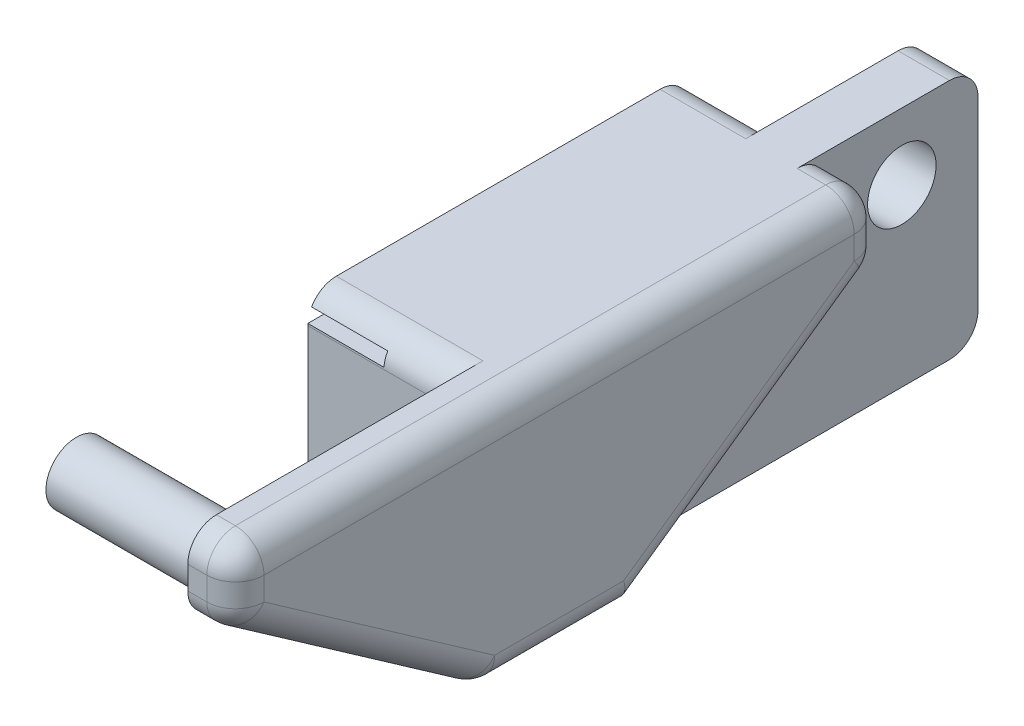
from build123d import *

# Parameters (mm, degrees)
BOSS_EXTRUDE1_DEPTH = 12.7
CUT_EXTRUDE2_DEPTH  = 4.5
CUT_EXTRUDE3_DEPTH  = 29.629690424
BOSS_EXTRUDE2_START = -7.7
SKETCH2_5_R         = 1.6
BOSS_EXTRUDE2_DEPTH = 9.1
SKETCH2_6_R         = 1.8
CUT_EXTRUDE4_DEPTH  = 29.629690424
SKETCH2_7_R         = 1.6
BOSS_EXTRUDE3_DEPTH = 1.4
SKETCH2_8_W         = 42
SKETCH2_8_H         = 0.65
CUT_EXTRUDE5_DEPTH  = 4
CUT_EXTRUDE6_REACH  = 31.158
SKETCH4_W           = 1.5
SKETCH4_H           = 28
CUT_EXTRUDE7_DEPTH  = 3
SKETCH6_W           = 2.1
SKETCH6_H           = 6.861038338
BOSS_EXTRUDE4_DEPTH = 1
CUT_EXTRUDE8_DEPTH  = 4.5
FILLET1_R           = 1.5
FILLET2_R           = 0.25


with BuildPart() as part:
    # Sketch1 → Boss-Extrude1 (new body)
    with BuildSketch(Plane(origin=(0, 0, 0), x_dir=(1, 0, 0), z_dir=(0, 1, 0))):
        Polygon((-28.77817965, 15.54419618), (-24.27817965, 15.54419618), (-24.27817965, 23.54419618), (-21.57817965, 23.54419618), (-21.57817965, 15.54419618), (-18.57817965, 15.54419618), (-18.57817965, -18.45580382), (-21.07817965, -18.45580382), (-21.07817965, -4.45580382), (-28.77817965, -4.45580382), align=None)
    extrude(amount=BOSS_EXTRUDE1_DEPTH)

    # Sketch2 → Cut-Extrude2 (cut)
    with BuildSketch(Plane.ZY.offset(28.77817965)):
        Polygon((-15.54419618, 5.764870839), (-15.54419618, 0), (-7.040359819, 0), align=None)
    extrude(amount=-CUT_EXTRUDE2_DEPTH, mode=Mode.SUBTRACT)

    # Sketch2<4> → Cut-Extrude3 (cut, through all)
    with BuildSketch(Plane.ZY.offset(28.77817965)):
        Polygon((12.124702683, 0), (18.45580382, 0), (18.45580382, 9.2), align=None)
    extrude(amount=-CUT_EXTRUDE3_DEPTH, mode=Mode.SUBTRACT)

    # Sketch2<5> → Boss-Extrude2 (add)
    with BuildSketch(Plane.ZY.offset(28.77817965).offset(BOSS_EXTRUDE2_START)):
        with Locations(Location((15.20580382, 9.2, 0), (0, 0, 180))):
            Circle(SKETCH2_5_R)
    extrude(amount=BOSS_EXTRUDE2_DEPTH)

    # Sketch2<6> → Cut-Extrude4 (cut, through all)
    with BuildSketch(Plane.ZY.offset(28.77817965)):
        with Locations((-19.54419618, 9.2)):
            Circle(SKETCH2_6_R)
    extrude(amount=-CUT_EXTRUDE4_DEPTH, mode=Mode.SUBTRACT)

    # Sketch2<7> → Boss-Extrude3 (add)
    with BuildSketch(Plane.ZY.offset(28.77817965)):
        with Locations(Location((-12.29419618, 9.2, 0), (0, 0, 180))):
            Circle(SKETCH2_7_R)
    extrude(amount=BOSS_EXTRUDE3_DEPTH)

    # Sketch2<8> → Cut-Extrude5 (cut)
    with BuildSketch(Plane.ZY.offset(28.77817965)):
        with Locations((-2.54419618, 11.625)):
            Rectangle(SKETCH2_8_W, SKETCH2_8_H)
    extrude(amount=-CUT_EXTRUDE5_DEPTH, mode=Mode.SUBTRACT)

    # Cut-Extrude6: up to this face of the body (flat: up to its plane)
    cut_extrude6_end = Plane(part.part.faces().sort_by_distance((-21.57817965, 6.032683514, -19.54419618))[0])
    # Sketch3 → Cut-Extrude6 (cut, up to the picked face)
    with BuildSketch(Plane(origin=(-18.57817965, 0, 0), x_dir=(0, 0, -1), z_dir=(1, 0, 0)), mode=Mode.PRIVATE) as cut_extrude6_sk1:
        Polygon((15.54419618, 0), (15.54419618, 9.2), (2.405234518, 0), align=None)
    cut_extrude6_tool1 = split(extrude(cut_extrude6_sk1.sketch, amount=-CUT_EXTRUDE6_REACH, mode=Mode.PRIVATE), bisect_by=cut_extrude6_end, keep=Keep.BOTH, mode=Mode.PRIVATE)
    # Sketch3 → Cut-Extrude6 (cut, up to the picked face)
    with BuildSketch(Plane(origin=(-18.57817965, 0, 0), x_dir=(0, 0, -1), z_dir=(1, 0, 0)), mode=Mode.PRIVATE) as cut_extrude6_sk2:
        Polygon((-12.124702683, 0), (-18.45580382, 9.2), (-18.45580382, 0), align=None)
    cut_extrude6_tool2 = split(extrude(cut_extrude6_sk2.sketch, amount=-CUT_EXTRUDE6_REACH, mode=Mode.PRIVATE), bisect_by=cut_extrude6_end, keep=Keep.BOTH, mode=Mode.PRIVATE)
    # Sketch3 → Cut-Extrude6 (cut, up to the picked face)
    with BuildSketch(Plane(origin=(-18.57817965, 0, 0), x_dir=(0, 0, -1), z_dir=(1, 0, 0)), mode=Mode.PRIVATE) as cut_extrude6_sk3:
        Polygon((-5.316842158, 0), (-18.45580382, 9.2), (-12.124702683, 0), align=None)
    cut_extrude6_tool3 = split(extrude(cut_extrude6_sk3.sketch, amount=-CUT_EXTRUDE6_REACH, mode=Mode.PRIVATE), bisect_by=cut_extrude6_end, keep=Keep.BOTH, mode=Mode.PRIVATE)
    add(cut_extrude6_tool1.solids().sort_by(Axis((-18.57818, 3.066667, -11.164542), (-1, 0, 0)))[0], mode=Mode.SUBTRACT)
    add(cut_extrude6_tool2.solids().sort_by(Axis((-18.57818, 3.066667, 16.345437), (-1, 0, 0)))[0], mode=Mode.SUBTRACT)
    add(cut_extrude6_tool3.solids().sort_by(Axis((-18.57818, 3.066667, 11.965783), (-1, 0, 0)))[0], mode=Mode.SUBTRACT)

    # Sketch4 → Cut-Extrude7 (cut)
    with BuildSketch(Plane.XZ):
        with Locations((-22.92817965, -9.54419618)):
            Rectangle(SKETCH4_W, SKETCH4_H)
    extrude(amount=-CUT_EXTRUDE7_DEPTH, mode=Mode.SUBTRACT)

    # Sketch6 → Boss-Extrude4 (add)
    with BuildSketch(Plane(origin=(0, 0, 0), x_dir=(-1, 0, 0), z_dir=(0, -1, 0))):
        with Locations((22.62817965, -1.025284651)):
            Rectangle(SKETCH6_W, SKETCH6_H)
    extrude(amount=-BOSS_EXTRUDE4_DEPTH)

    # Sketch8 → Cut-Extrude8 (cut)
    with BuildSketch(Plane.ZY.offset(28.77817965)):
        Polygon((-15.54419618, 0), (-7.040359819, 0), (-15.54419618, 5.764870839), align=None)
        Polygon((-7.040359819, 0), (-2.405234518, 0), (-15.54419618, 9.2), (-15.54419618, 5.764870839), align=None)
    extrude(amount=-CUT_EXTRUDE8_DEPTH, mode=Mode.SUBTRACT)

    # Fillet1
    # the kernel refuses this fillet: 1.5 mm, written as the material it takes off along each edge
    with BuildSketch(Plane(origin=(-20.07817965, 9.980850576, 16.95580382), x_dir=(0, 0, 1), z_dir=(1, 0, 0))) as fillet1_piece_1_section:
        Polygon((0, 0), (FILLET1_R, 0), (FILLET1_R, FILLET1_R * 0.520567050552), (FILLET1_R * 0.573576436351, FILLET1_R * 0.819152044289), align=None)
    fillet1_piece_1 = extrude(amount=FILLET1_R, mode=Mode.PRIVATE)
    fillet1_piece_1 = fillet1_piece_1 - Plane(origin=(-20.07817965, 9.980850576, 16.95580382), x_dir=(0, 0.46174861323503175, -0.8870108331782229), z_dir=(1, 0, 0)) * Sphere(FILLET1_R, mode=Mode.PRIVATE)
    add(fillet1_piece_1, mode=Mode.SUBTRACT)
    with BuildSketch(Plane(origin=(-20.07817965, 11.2, 16.95580382), x_dir=(1, 0, 0), z_dir=(0, 1, 0))) as fillet1_piece_2_section:
        Polygon((0, 0), (FILLET1_R, 0), (FILLET1_R, -FILLET1_R), (0, -FILLET1_R), align=None)
    fillet1_piece_2 = extrude(amount=FILLET1_R, mode=Mode.PRIVATE)
    fillet1_piece_2 = fillet1_piece_2 - Plane(origin=(-20.07817965, 11.2, 16.95580382), x_dir=(-0.7071067811865476, 0, -0.7071067811865474), z_dir=(0, 1, 0)) * Sphere(FILLET1_R, mode=Mode.PRIVATE)
    add(fillet1_piece_2, mode=Mode.SUBTRACT)
    with BuildSketch(Plane(origin=(-20.07817965, 1.5, 4.843893974), x_dir=(0, -0.8191520442889889, 0.5735764363510503), z_dir=(1, 0, 0))) as fillet1_piece_3_section:
        Polygon((0, 0), (FILLET1_R, 0), (FILLET1_R, FILLET1_R * 0.315298788879), (FILLET1_R * 0.819152044289, FILLET1_R * 0.573576436351), align=None)
    fillet1_piece_3 = extrude(amount=FILLET1_R, mode=Mode.PRIVATE)
    fillet1_piece_3 = fillet1_piece_3 - Plane(origin=(-20.07817965, 1.5, 4.843893974), x_dir=(0, 0.9537169507482263, -0.30070579950427556), z_dir=(1, 0, 0)) * Sphere(FILLET1_R, mode=Mode.PRIVATE)
    add(fillet1_piece_3, mode=Mode.SUBTRACT)
    with BuildSketch(Plane(origin=(-20.07817965, 9.980850576, -14.04419618), x_dir=(0, 0, -1), z_dir=(1, 0, 0))) as fillet1_piece_4_section:
        Polygon((0, 0), (FILLET1_R, 0), (FILLET1_R, -FILLET1_R * 0.520567050552), (FILLET1_R * 0.573576436351, -FILLET1_R * 0.819152044289), align=None)
    fillet1_piece_4 = extrude(amount=FILLET1_R, mode=Mode.PRIVATE)
    fillet1_piece_4 = fillet1_piece_4 - Plane(origin=(-20.07817965, 9.980850576, -14.04419618), x_dir=(0, 0.4617486132350316, 0.8870108331782229), z_dir=(1, 0, 0)) * Sphere(FILLET1_R, mode=Mode.PRIVATE)
    add(fillet1_piece_4, mode=Mode.SUBTRACT)
    with BuildSketch(Plane(origin=(-20.07817965, 11.2, -14.04419618), x_dir=(1, 0, 0), z_dir=(0, 1, 0))) as fillet1_piece_5_section:
        Polygon((0, 0), (FILLET1_R, 0), (FILLET1_R, FILLET1_R), (0, FILLET1_R), align=None)
    fillet1_piece_5 = extrude(amount=FILLET1_R, mode=Mode.PRIVATE)
    fillet1_piece_5 = fillet1_piece_5 - Plane(origin=(-20.07817965, 11.2, -14.04419618), x_dir=(-0.7071067811865475, 0, 0.7071067811865477), z_dir=(0, 1, 0)) * Sphere(FILLET1_R, mode=Mode.PRIVATE)
    add(fillet1_piece_5, mode=Mode.SUBTRACT)
    with BuildSketch(Plane(origin=(-21.07817965, 0, 4.45580382), x_dir=(0, 1, 0), z_dir=(-1, 0, 0))) as fillet1_piece_6:
        with BuildLine():
            CenterArc((FILLET1_R, FILLET1_R), FILLET1_R, 180, 90)
            Line((0, FILLET1_R), (0, 0))
            Line((0, 0), (FILLET1_R, 0))
        make_face()
    extrude(amount=11.45, mode=Mode.SUBTRACT)
    with BuildSketch(Plane(origin=(-21.07817965, 12.7, 4.45580382), x_dir=(0, -1, 0), z_dir=(-1, 0, 0))) as fillet1_piece_7:
        with BuildLine():
            CenterArc((FILLET1_R, -FILLET1_R), FILLET1_R, 90, 90)
            Line((0, -FILLET1_R), (0, 0))
            Line((0, 0), (FILLET1_R, 0))
        make_face()
    extrude(amount=11.45, mode=Mode.SUBTRACT)
    with BuildSketch(Plane(origin=(-25.92817965, 0, -23.54419618), x_dir=(0, 1, 0), z_dir=(1, 0, 0)), Plane(origin=(-28.02817965, 0, -23.54419618), x_dir=(0, 1, 0), z_dir=(1, 0, 0))) as fillet1_piece_8:
        with BuildLine():
            CenterArc((FILLET1_R, FILLET1_R), FILLET1_R, 180, 90)
            Line((0, FILLET1_R), (0, 0))
            Line((0, 0), (FILLET1_R, 0))
        make_face()
    extrude(amount=8.1, mode=Mode.SUBTRACT)
    with BuildSketch(Plane(origin=(-28.02817965, 12.7, -23.54419618), x_dir=(0, -1, 0), z_dir=(1, 0, 0))) as fillet1_piece_9:
        with BuildLine():
            CenterArc((FILLET1_R, -FILLET1_R), FILLET1_R, 90, 90)
            Line((0, -FILLET1_R), (0, 0))
            Line((0, 0), (FILLET1_R, 0))
        make_face()
    extrude(amount=10.2, mode=Mode.SUBTRACT)
    with BuildSketch(Plane(origin=(-18.57817965, 9.980850576, 18.45580382), x_dir=(0, 0, -1), z_dir=(0, 1, 0))) as fillet1_piece_10:
        with BuildLine():
            CenterArc((FILLET1_R, FILLET1_R), FILLET1_R, 180, 90)
            Line((0, FILLET1_R), (0, 0))
            Line((0, 0), (FILLET1_R, 0))
        make_face()
    extrude(amount=1.219149424, mode=Mode.SUBTRACT)
    with BuildSketch(Plane(origin=(-23.03030609, 9.2, 18.45580382), x_dir=(0, 1, 0), z_dir=(1, 0, 0))) as fillet1_piece_11:
        with BuildLine():
            CenterArc((FILLET1_R * 0.520567050552, -FILLET1_R), FILLET1_R, 90, 55)
            Line((-FILLET1_R * 0.298584993737, -FILLET1_R * 0.426423563649), (0, 0))
            Line((0, 0), (FILLET1_R * 0.520567050552, 0))
        make_face()
    extrude(amount=2.95212644, mode=Mode.SUBTRACT)
    with BuildSketch(Plane(origin=(-20.07817965, 12.7, 18.45580382), x_dir=(0, -1, 0), z_dir=(-1, 0, 0))) as fillet1_piece_12:
        with BuildLine():
            CenterArc((FILLET1_R, -FILLET1_R), FILLET1_R, 90, 90)
            Line((0, -FILLET1_R), (0, 0))
            Line((0, 0), (FILLET1_R, 0))
        make_face()
    extrude(amount=4.75, mode=Mode.SUBTRACT)
    with BuildSketch(Plane(origin=(-20.07817965, 0, 5.316842158), x_dir=(0, 0.573576436351042, 0.8191520442889947), z_dir=(-1, 0, 0))) as fillet1_piece_13:
        with BuildLine():
            CenterArc((FILLET1_R * 0.315298788879, FILLET1_R), FILLET1_R, 235, 35)
            Line((-FILLET1_R * 0.258277647472, FILLET1_R * 0.180847955711), (0, 0))
            Line((0, 0), (FILLET1_R * 0.315298788879, 0))
        make_face()
    extrude(amount=2.182370458, mode=Mode.SUBTRACT)
    with BuildSketch(Plane(origin=(-18.57817965, 0.271271934, 5.704258629), x_dir=(2.3684757858670013e-15, 0.8191520442889889, -0.5735764363510503), z_dir=(0, 0.5735764363510503, 0.8191520442889889))) as fillet1_piece_14:
        with BuildLine():
            CenterArc((FILLET1_R, FILLET1_R), FILLET1_R, 180, 90)
            Line((0, FILLET1_R), (0, 0))
            Line((0, 0), (FILLET1_R, 0))
        make_face()
    extrude(amount=14.785911761, mode=Mode.SUBTRACT)
    with BuildSketch(Plane(origin=(-18.57817965, 0, -6.155234518), x_dir=(0, 1, 0), z_dir=(0, 0, 1))) as fillet1_piece_15:
        with BuildLine():
            CenterArc((FILLET1_R, FILLET1_R), FILLET1_R, 180, 90)
            Line((0, FILLET1_R), (0, 0))
            Line((0, 0), (FILLET1_R, 0))
        make_face()
    extrude(amount=10.999128493, mode=Mode.SUBTRACT)
    with BuildSketch(Plane(origin=(-18.57817965, 8.752122509, -14.904560835), x_dir=(-1, 0, 0), z_dir=(0, -0.5735764363510504, 0.8191520442889888))) as fillet1_piece_16:
        with BuildLine():
            CenterArc((FILLET1_R, -FILLET1_R), FILLET1_R, 90, 90)
            Line((0, -FILLET1_R), (0, 0))
            Line((0, 0), (FILLET1_R, 0))
        make_face()
    extrude(amount=19.008859944, mode=Mode.SUBTRACT)
    with BuildSketch(Plane(origin=(-20.07817965, 9.2, -15.54419618), x_dir=(0, -0.5735764363510506, 0.8191520442889886), z_dir=(-1, 0, 0))) as fillet1_piece_17:
        with BuildLine():
            CenterArc((FILLET1_R * 0.520567050552, FILLET1_R), FILLET1_R, 215, 55)
            Line((-FILLET1_R * 0.298584993737, FILLET1_R * 0.426423563649), (0, 0))
            Line((0, 0), (FILLET1_R * 0.520567050552, 0))
        make_face()
    extrude(amount=1.5, mode=Mode.SUBTRACT)
    with BuildSketch(Plane(origin=(-18.57817965, 9.980850576, -15.54419618), x_dir=(0, 0, 1), z_dir=(0, 1, 0))) as fillet1_piece_18:
        with BuildLine():
            CenterArc((FILLET1_R, -FILLET1_R), FILLET1_R, 90, 90)
            Line((0, -FILLET1_R), (0, 0))
            Line((0, 0), (FILLET1_R, 0))
        make_face()
    extrude(amount=1.219149424, mode=Mode.SUBTRACT)
    with BuildSketch(Plane(origin=(-32.52817965, 12.7, -15.54419618), x_dir=(0, 0, 1), z_dir=(1, 0, 0))) as fillet1_piece_19:
        with BuildLine():
            CenterArc((FILLET1_R, FILLET1_R), FILLET1_R, 180, 90)
            Line((0, FILLET1_R), (0, 0))
            Line((0, 0), (FILLET1_R, 0))
        make_face()
    extrude(amount=8.25, mode=Mode.SUBTRACT)
    with BuildSketch(Plane(origin=(-32.52817965, 12.7, -15.54419618), x_dir=(0, 0, 1), z_dir=(1, 0, 0))) as fillet1_piece_20_section:
        with BuildLine():
            CenterArc((FILLET1_R, FILLET1_R), FILLET1_R, 180, 90)
            Line((0, FILLET1_R), (0, 0))
            Line((0, 0), (FILLET1_R, 0))
        make_face()
    fillet1_piece_20 = extrude(amount=12, mode=Mode.PRIVATE)
    fillet1_piece_20 = split(fillet1_piece_20, bisect_by=Plane(origin=(-21.57817965, 12.360407329, -15.204603509), z_dir=(1, 0, 0)), keep=Keep.TOP, mode=Mode.PRIVATE)
    add(fillet1_piece_20, mode=Mode.SUBTRACT)
    with BuildSketch(Plane(origin=(-25.32817965, 12.7, -15.54419618), x_dir=(0, -1, 0), z_dir=(1, 0, 0))) as fillet1_piece_21_section:
        with BuildLine():
            CenterArc((FILLET1_R, -FILLET1_R), FILLET1_R, 90, 90)
            Line((0, -FILLET1_R), (0, 0))
            Line((0, 0), (FILLET1_R, 0))
        make_face()
    fillet1_piece_21 = extrude(amount=5.25, mode=Mode.PRIVATE)
    fillet1_piece_21 = split(fillet1_piece_21, bisect_by=Plane(origin=(-24.27817965, 12.360407329, -15.204603509), z_dir=(-1, 0, 0)), keep=Keep.TOP, mode=Mode.PRIVATE)
    add(fillet1_piece_21, mode=Mode.SUBTRACT)
    with BuildSketch(Plane(origin=(-21.57817965, 12.7, -15.54419618), x_dir=(0, -1, 0), z_dir=(1, 0, 0))) as fillet1_piece_22:
        with BuildLine():
            CenterArc((FILLET1_R, -FILLET1_R), FILLET1_R, 90, 90)
            Line((0, -FILLET1_R), (0, 0))
            Line((0, 0), (FILLET1_R, 0))
        make_face()
    extrude(amount=1.5, mode=Mode.SUBTRACT)
    with BuildSketch(Plane(origin=(-18.57817965, 12.7, -14.04419618), x_dir=(0, -1, 0), z_dir=(0, 0, 1))) as fillet1_piece_23:
        with BuildLine():
            CenterArc((FILLET1_R, -FILLET1_R), FILLET1_R, 90, 90)
            Line((0, -FILLET1_R), (0, 0))
            Line((0, 0), (FILLET1_R, 0))
        make_face()
    extrude(amount=31, mode=Mode.SUBTRACT)
    with BuildSketch(Plane(origin=(-29.960550109, 0, -2.405234518), x_dir=(0, 0.5735764363510496, -0.8191520442889895), z_dir=(1, 0, 0))) as fillet1_piece_24:
        with BuildLine():
            CenterArc((FILLET1_R * 0.315298788879, FILLET1_R), FILLET1_R, 235, 35)
            Line((-FILLET1_R * 0.258277647472, FILLET1_R * 0.180847955711), (0, 0))
            Line((0, 0), (FILLET1_R * 0.315298788879, 0))
        make_face()
    extrude(amount=5.682370458, mode=Mode.SUBTRACT)
    with BuildSketch(Plane(origin=(-30.73030609, 9.2, -15.54419618), x_dir=(0, 1, 0), z_dir=(1, 0, 0))) as fillet1_piece_25:
        with BuildLine():
            CenterArc((FILLET1_R * 0.520567050552, FILLET1_R), FILLET1_R, 215, 55)
            Line((-FILLET1_R * 0.298584993737, FILLET1_R * 0.426423563649), (0, 0))
            Line((0, 0), (FILLET1_R * 0.520567050552, 0))
        make_face()
    extrude(amount=6.45212644, mode=Mode.SUBTRACT)

    # Fillet2
    fillet2_edges = [part.edges().sort_by_distance(p)[0] for p in [
        (-22.17817965, 3, -9.54419618),
        (-22.17817965, 2.25, 4.45580382),
        (-22.92817965, 3, -23.54419618),
        (-22.17817965, 2.25, -23.54419618),
        (-23.67817965, 3, -9.54419618),
        (-23.67817965, 2.25, -23.54419618),
        (-22.92817965, 3, 4.45580382),
        (-23.67817965, 2.25, 4.45580382),
        (-23.67817965, 0, -12.224715349),
        (-22.17817965, 0, -12.224715349),
        (-23.67817965, 0.439339828, -23.104856352),
        (-23.67817965, 1.246347032, 4.434201659),
        (-22.17817965, 0.439339828, -23.104856352),
        (-22.17817965, 1.246347032, 4.434201659),
    ]]
    fillet(fillet2_edges, radius=FILLET2_R)


solid = part.part
